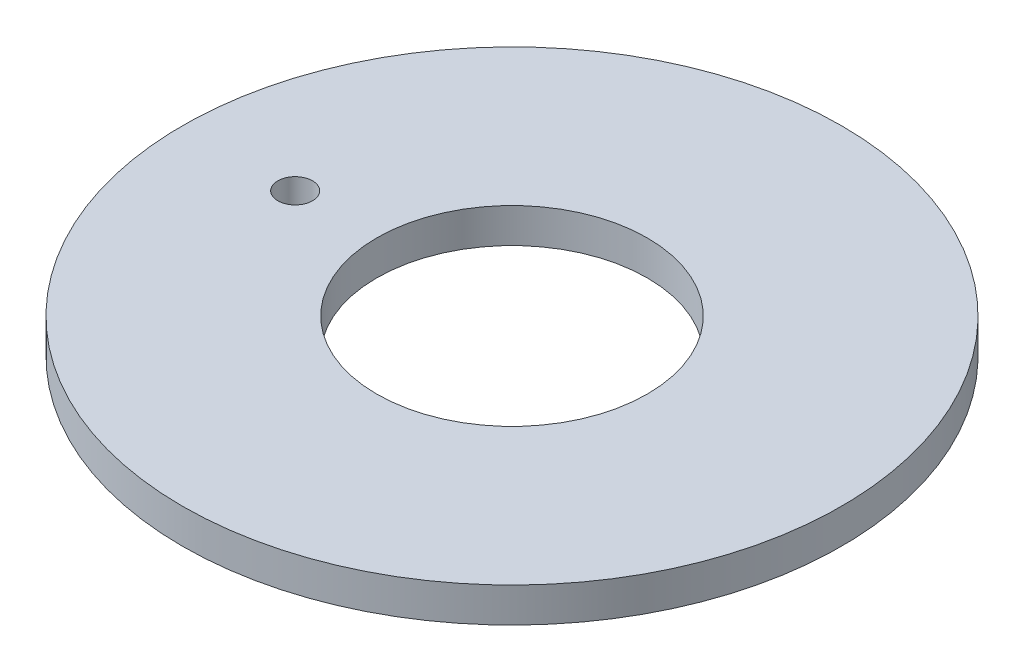
from build123d import *

# Parameters (mm, degrees)
SKETCH1_R           = 38
SKETCH1_R_2         = 15.6
BOSS_EXTRUDE1_DEPTH = 4
SKETCH2_R           = 2
CUT_EXTRUDE1_DEPTH  = 54.888774341


with BuildPart() as part:
    # Sketch1 → Boss-Extrude1 (new body)
    with BuildSketch(Plane(origin=(0, 0, 0), x_dir=(1, 0, 0), z_dir=(0, 1, 0))):
        Circle(SKETCH1_R)
        Circle(SKETCH1_R_2, mode=Mode.SUBTRACT)
    extrude(amount=BOSS_EXTRUDE1_DEPTH)

    # Sketch2 → Cut-Extrude1 (cut, through all)
    with BuildSketch(Plane(origin=(0, 4, 0), x_dir=(1, 0, 0), z_dir=(0, 1, 0))):
        with Locations((-25, 0)):
            Circle(SKETCH2_R)
    extrude(amount=-CUT_EXTRUDE1_DEPTH, mode=Mode.SUBTRACT)


solid = part.part
